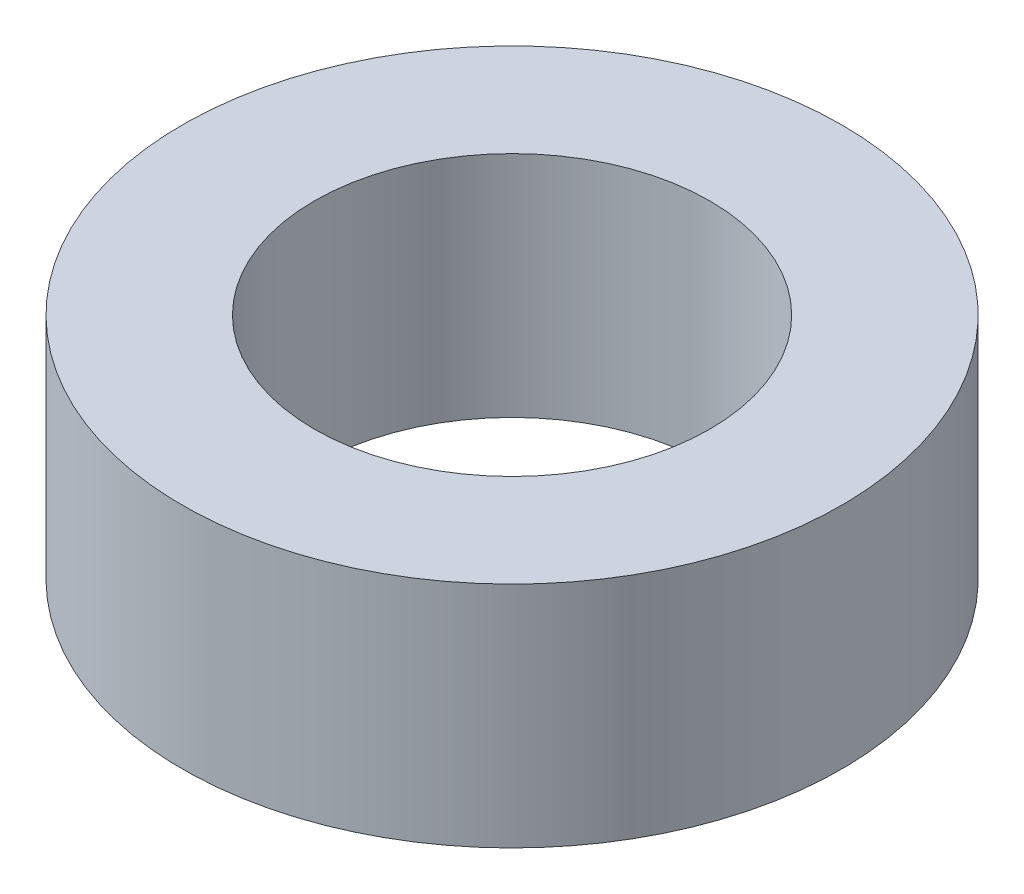
from build123d import *

# Parameters (mm, degrees)
SKETCH1_R           = 37.5
BOSS_EXTRUDE1_DEPTH = 26
SKETCH2_R           = 22.5
CUT_EXTRUDE1_DEPTH  = 60.063525123


with BuildPart() as part:
    # Sketch1 → Boss-Extrude1 (new body)
    with BuildSketch(Plane(origin=(0, 0, 0), x_dir=(1, 0, 0), z_dir=(0, 1, 0))):
        Circle(SKETCH1_R)
    extrude(amount=BOSS_EXTRUDE1_DEPTH)

    # Sketch2 → Cut-Extrude1 (cut, through all)
    with BuildSketch(Plane(origin=(0, 0, 0), x_dir=(1, 0, 0), z_dir=(0, 1, 0))):
        Circle(SKETCH2_R)
    extrude(amount=CUT_EXTRUDE1_DEPTH, mode=Mode.SUBTRACT)


solid = part.part
